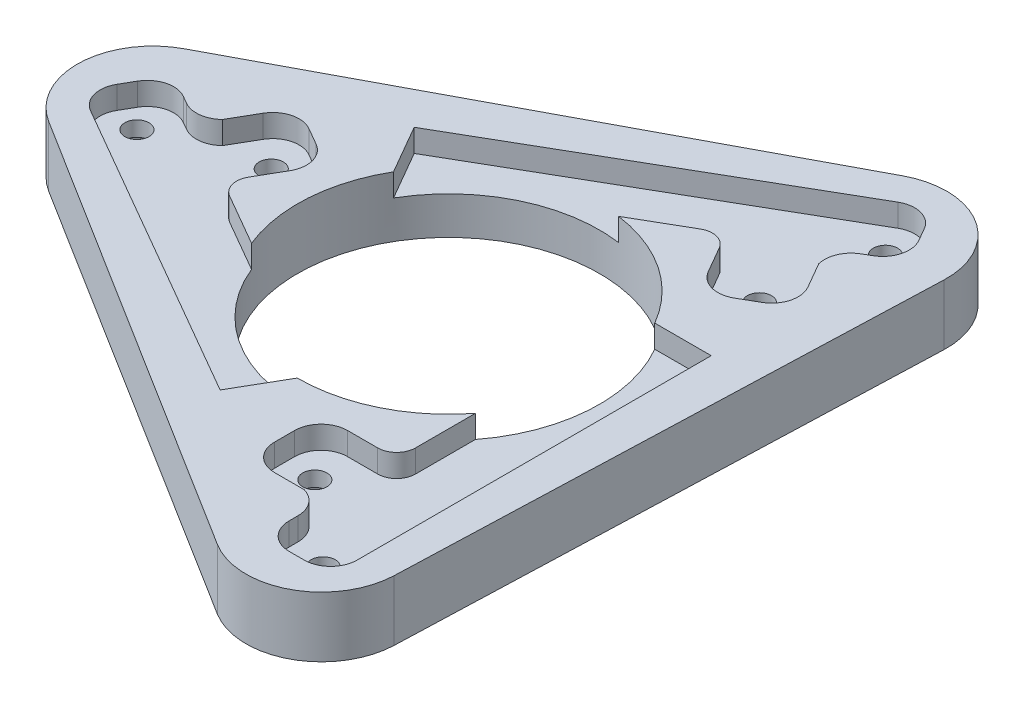
from build123d import *

# Parameters (mm, degrees)
ESQUISSE5_R             = 20
BOSS_EXTRU_1_DEPTH      = 8
ENL_V_MAT_EXTRU_1_DEPTH = 3
D_GAGEMENT_M32_D        = 3.2
ENL_V_MAT_EXTRU_3_DEPTH = 3
CONG_1_R                = 10


with BuildPart() as part:
    # Esquisse5 → Boss.-Extru.1 (new body)
    with BuildSketch(Plane(origin=(0, 0, 0), x_dir=(1, 0, 0), z_dir=(0, 1, 0))):
        Polygon((28.432548735, -53.540546994), (32.151199462, 51.393582996), (-60.583748197, 2.146963998), align=None)
        Circle(ESQUISSE5_R, mode=Mode.SUBTRACT)
    extrude(amount=BOSS_EXTRU_1_DEPTH)

    # Esquisse8 → Enlèv. mat.-Extru.1 (cut)
    with BuildSketch(Plane(origin=(0, 8, 0), x_dir=(1, 0, 0), z_dir=(0, 1, 0))):
        with BuildLine():
            Line((21.387702746, 27.639680694), (23.353855838, 24.234203642))
            ThreePointArc((23.353855838, 24.234203642), (23.703507317, 21.578336984), (22.072766925, 19.453114729))
            Line((22.072766925, 19.453114729), (19.768919347, 18.12298771))
            ThreePointArc((19.768919347, 18.12298771), (17.11305269, 17.773336231), (14.987830434, 19.404076623))
            Line((14.987830434, 19.404076623), (12.987830434, 22.868178239))
            ThreePointArc((12.987830434, 22.868178239), (11.469814538, 24.032992804), (9.572766925, 23.783241748))
            Line((9.572766925, 23.783241748), (-16.542931679, 8.705336129))
            Line((-16.542931679, 8.705336129), (-21.042931679, 16.499564763))
            Line((-21.042931679, 16.499564763), (19.563147982, 39.943495786))
            ThreePointArc((19.563147982, 39.943495786), (22.219014639, 40.293147265), (24.344236895, 38.662406873))
            Line((24.344236895, 38.662406873), (25.344236895, 36.930356065))
            ThreePointArc((25.344236895, 36.930356065), (25.693888374, 34.274489407), (24.063147982, 32.149267152))
            Line((24.063147982, 32.149267152), (23.052120727, 31.565550294))
            ThreePointArc((23.052120727, 31.565550294), (21.562648237, 29.881269983), (21.387702746, 27.639680694))
        make_face()
        with BuildLine():
            Line((-34.630517006, 4.702453559), (-32.664363914, 8.107930611))
            ThreePointArc((-32.664363914, 8.107930611), (-30.539141658, 9.738671003), (-27.883275, 9.389019524))
            Line((-27.883275, 9.389019524), (-25.579427423, 8.058892505))
            ThreePointArc((-25.579427423, 8.058892505), (-23.948687031, 5.93367025), (-24.29833851, 3.277803592))
            Line((-24.29833851, 3.277803592), (-26.29833851, -0.186298023))
            ThreePointArc((-26.29833851, -0.186298023), (-26.548089566, -2.083345636), (-25.383275, -3.601361533))
            Line((-25.383275, -3.601361533), (0.732423604, -18.679267152))
            Line((0.732423604, -18.679267152), (-3.767576396, -26.473495786))
            Line((-3.767576396, -26.473495786), (-44.373656057, -3.029564763))
            ThreePointArc((-44.373656057, -3.029564763), (-46.004396449, -0.904342507), (-45.65474497, 1.75152415))
            Line((-45.65474497, 1.75152415), (-44.65474497, 3.483574958))
            ThreePointArc((-44.65474497, 3.483574958), (-42.529522715, 5.11431535), (-39.873656057, 4.764663871))
            Line((-39.873656057, 4.764663871), (-38.862628803, 4.180947014))
            ThreePointArc((-38.862628803, 4.180947014), (-36.659263021, 3.733166155), (-34.630517006, 4.702453559))
        make_face()
        with BuildLine():
            Line((13.24281426, -32.342134253), (9.310508076, -32.342134253))
            ThreePointArc((9.310508076, -32.342134253), (6.835634342, -31.317007987), (5.810508076, -28.842134253))
            Line((5.810508076, -28.842134253), (5.810508076, -26.181880215))
            ThreePointArc((5.810508076, -26.181880215), (6.835634342, -23.707006481), (9.310508076, -22.681880215))
            Line((9.310508076, -22.681880215), (13.310508076, -22.681880215))
            ThreePointArc((13.310508076, -22.681880215), (15.078275029, -21.949647168), (15.810508076, -20.181880215))
            Line((15.810508076, -20.181880215), (15.810508076, 9.973931023))
            Line((15.810508076, 9.973931023), (24.810508076, 9.973931023))
            Line((24.810508076, 9.973931023), (24.810508076, -36.913931023))
            ThreePointArc((24.810508076, -36.913931023), (23.78538181, -39.388804757), (21.310508076, -40.413931023))
            Line((21.310508076, -40.413931023), (19.310508076, -40.413931023))
            ThreePointArc((19.310508076, -40.413931023), (16.835634342, -39.388804757), (15.810508076, -36.913931023))
            Line((15.810508076, -36.913931023), (15.810508076, -35.746497308))
            ThreePointArc((15.810508076, -35.746497308), (15.096614784, -33.614436138), (13.24281426, -32.342134253))
        make_face()
    extrude(amount=-ENL_V_MAT_EXTRU_1_DEPTH, mode=Mode.SUBTRACT)

    # Dégagement M32 (through all)
    with Locations(Plane(origin=(0, 5, 0), x_dir=(1, 0, 0), z_dir=(0, 1, 0))):
        with Locations((-42.123656057, 0.867549554), (-28.731351212, 5.2598544), (18.920843136, 22.252152835), (21.813147982, 36.046381469), (9.810508076, -27.512007234), (20.310508076, -36.913931023)):
            Hole(D_GAGEMENT_M32_D / 2)

    # Esquisse15 → Enlèv. mat.-Extru.3 (cut)
    with BuildSketch(Plane(origin=(0, 0, 0), x_dir=(-1, 0, 0), z_dir=(0, -1, 0))):
        Polygon((40.111665719, -1.663305679), (43.309445813, -2.140312808), (45.321436152, 0.390542426), (44.135646396, 3.398404787), (40.937866301, 3.875411916), (38.925875963, 1.344556683), align=None)
        Polygon((-24.411542654, 34.122406817), (-21.446134393, 32.834118348), (-18.847739721, 34.758093), (-19.214753309, 37.970356121), (-22.18016157, 39.25864459), (-24.778556242, 37.334669938), align=None)
        Polygon((-23.23576284, -38.290963301), (-20.580590524, -40.135792101), (-17.655335759, -38.758759823), (-17.385253311, -35.536898745), (-20.040425628, -33.692069945), (-22.965680393, -35.069102223), align=None)
        Polygon((-6.577346568, -27.512007234), (-8.193927322, -24.712007234), (-11.427088829, -24.712007234), (-13.043669583, -27.512007234), (-11.427088829, -30.312007234), (-8.193927322, -30.312007234), align=None)
        Polygon((31.880876504, 4.529221956), (30.938860115, 7.622107091), (27.789334822, 8.352739534), (25.58182592, 5.990486843), (26.523842309, 2.897601708), (29.673367601, 2.166969265), align=None)
        Polygon((-15.771317844, 22.982785278), (-17.978826747, 25.345037969), (-21.128352039, 24.614405526), (-22.070368428, 21.521520392), (-19.862859526, 19.1592677), (-16.713334233, 19.889900143), align=None)
    extrude(amount=-ENL_V_MAT_EXTRU_3_DEPTH, mode=Mode.SUBTRACT)

    # Congé1
    cong_1_edges = [part.edges().sort_by_distance(p)[0] for p in [
        (32.151199462, 4, -51.393582996),
        (28.432548735, 4, 53.540546994),
        (-60.583748197, 4, -2.146963998),
    ]]
    fillet(cong_1_edges, radius=CONG_1_R)


solid = part.part
